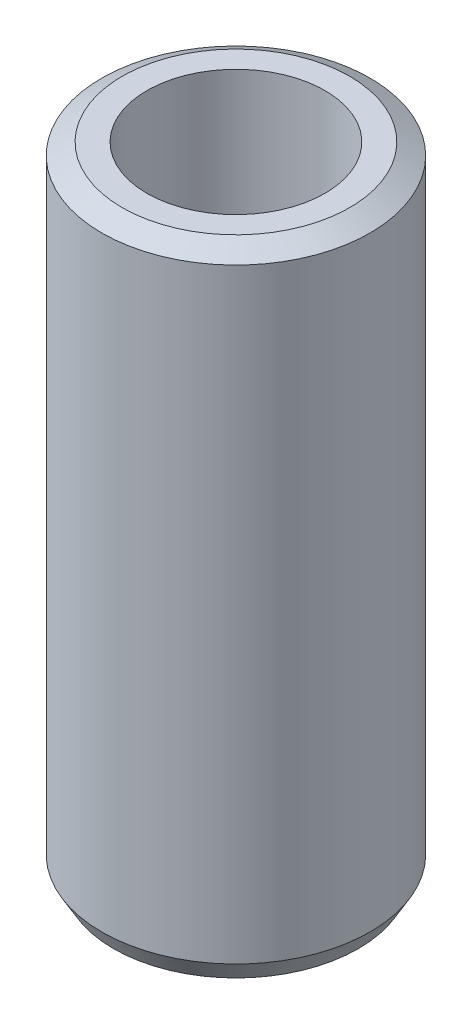
from build123d import *
from OCP.BRepFilletAPI import BRepFilletAPI_MakeChamfer

# Parameters (mm, degrees)
SKETCH1_R           = 27.5
BOSS_EXTRUDE1_DEPTH = 130.671147761
SKETCH2_R           = 18.251921951
CUT_EXTRUDE1_DEPTH  = 137.335794483
CHAMFER1_SIZE       = 2.413179243
CHAMFER1_SIZE2      = 4.179749057


with BuildPart() as part:
    # Sketch1 → Boss-Extrude1 (new body)
    with BuildSketch(Plane(origin=(0, 0, 0), x_dir=(1, 0, 0), z_dir=(0, 1, 0))):
        Circle(SKETCH1_R)
    extrude(amount=BOSS_EXTRUDE1_DEPTH)

    # Sketch2 → Cut-Extrude1 (cut, through all)
    with BuildSketch(Plane(origin=(0, 0, 0), x_dir=(1, 0, 0), z_dir=(0, 1, 0))):
        Circle(SKETCH2_R)
    extrude(amount=CUT_EXTRUDE1_DEPTH, mode=Mode.SUBTRACT)

    # Chamfer1: one chamfer whose edges measure the first distance from different faces: ONE call of the kernel's chamfer builder (chamfer() names one face for all edges)
    chamfer1_edges_1 = [part.edges().sort_by_distance(p)[0] for p in [
        (-27.5, 130.671147761, 0),
    ]]
    chamfer1_side_1 = [part.faces().sort_by_distance(p)[0] for p in [
        (-27.5, 65.335573881, 0),
    ]]
    chamfer1_edges_2 = [part.edges().sort_by_distance(p)[0] for p in [
        (-27.5, 0, 0),
    ]]
    chamfer1_side_2 = [part.faces().sort_by_distance(p)[0] for p in [
        (-26.722182541, 0, 0),
    ]]
    chamfer1 = BRepFilletAPI_MakeChamfer(part.part.solid().wrapped)
    for e in chamfer1_edges_1:
        chamfer1.Add(CHAMFER1_SIZE, CHAMFER1_SIZE2, e.wrapped, chamfer1_side_1[0].wrapped)  # the first distance lies on this face
    for e in chamfer1_edges_2:
        chamfer1.Add(CHAMFER1_SIZE, CHAMFER1_SIZE2, e.wrapped, chamfer1_side_2[0].wrapped)  # the first distance lies on this face
    add(Compound.cast(chamfer1.Shape()), mode=Mode.REPLACE)


solid = part.part
